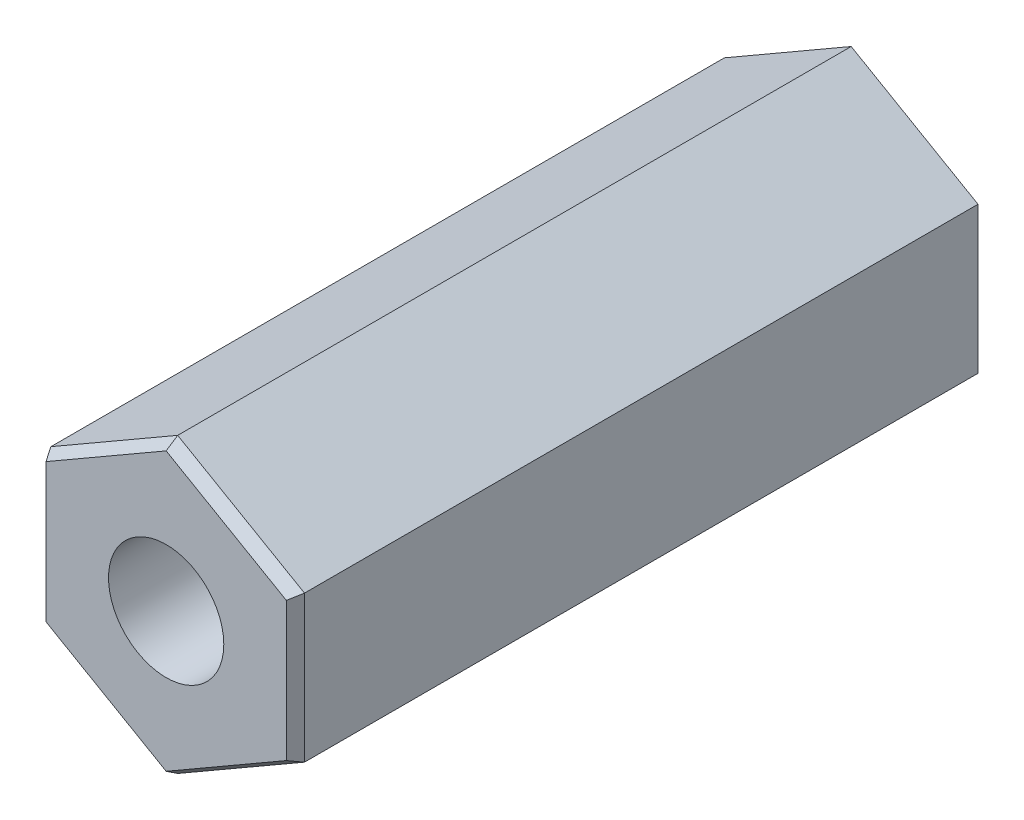
from build123d import *
from OCP.BRepFilletAPI import BRepFilletAPI_MakeChamfer

# Parameters (mm, degrees)
EXTRUDE_1_DEPTH    = 7.5
HOLE_WIZARD_M3_1_D = 2.5
CHAMFER_2_SIZE     = 0.25
CHAMFER_2_SIZE2    = 0.144337567


with BuildPart() as part:
    # ｽｹｯﾁ1 → ﾎﾞｽ - 押し出し1 (new, symmetric)
    with BuildSketch(Plane.XY):
        Polygon((-2.75, 1.58771324), (-2.75, -1.58771324), (0, -3.175426481), (2.75, -1.58771324), (2.75, 1.58771324), (0, 3.175426481), align=None)
    extrude(amount=EXTRUDE_1_DEPTH, both=True)

    # M3 ねじ穴1 (through all)
    with Locations(Plane.XY.offset(7.5)):
        with Locations((0, 0)):
            Hole(HOLE_WIZARD_M3_1_D / 2)

    # 面取り2: one chamfer whose edges measure the first distance from different faces: ONE call of the kernel's chamfer builder (chamfer() names one face for all edges)
    chamfer_2_edges_1 = [part.edges().sort_by_distance(p)[0] for p in [
        (-1.375, 2.38156986, 7.5),
    ]]
    chamfer_2_side_1 = [part.faces().sort_by_distance(p)[0] for p in [
        (-1.375, 2.38156986, 0),
    ]]
    chamfer_2_edges_2 = [part.edges().sort_by_distance(p)[0] for p in [
        (1.375, 2.38156986, 7.5),
    ]]
    chamfer_2_side_2 = [part.faces().sort_by_distance(p)[0] for p in [
        (1.375, 2.38156986, 0),
    ]]
    chamfer_2_edges_3 = [part.edges().sort_by_distance(p)[0] for p in [
        (2.75, 0, 7.5),
    ]]
    chamfer_2_side_3 = [part.faces().sort_by_distance(p)[0] for p in [
        (2.75, 0, 0),
    ]]
    chamfer_2_edges_4 = [part.edges().sort_by_distance(p)[0] for p in [
        (1.375, -2.38156986, 7.5),
    ]]
    chamfer_2_side_4 = [part.faces().sort_by_distance(p)[0] for p in [
        (1.375, -2.38156986, 0),
    ]]
    chamfer_2_edges_5 = [part.edges().sort_by_distance(p)[0] for p in [
        (-1.375, -2.38156986, 7.5),
    ]]
    chamfer_2_side_5 = [part.faces().sort_by_distance(p)[0] for p in [
        (-1.375, -2.38156986, 0),
    ]]
    chamfer_2_edges_6 = [part.edges().sort_by_distance(p)[0] for p in [
        (-2.75, 0, 7.5),
    ]]
    chamfer_2_side_6 = [part.faces().sort_by_distance(p)[0] for p in [
        (-2.75, 0, 0),
    ]]
    chamfer_2_edges_7 = [part.edges().sort_by_distance(p)[0] for p in [
        (2.75, 0, -7.5),
        (1.375, -2.38156986, -7.5),
        (-1.375, -2.38156986, -7.5),
        (-2.75, 0, -7.5),
        (-1.375, 2.38156986, -7.5),
        (1.375, 2.38156986, -7.5),
    ]]
    chamfer_2_side_7 = [part.faces().sort_by_distance(p)[0] for p in [
        (-2.665986112, 0, -7.5),
    ]]
    chamfer_2 = BRepFilletAPI_MakeChamfer(part.part.solid().wrapped)
    for e in chamfer_2_edges_1:
        chamfer_2.Add(CHAMFER_2_SIZE, CHAMFER_2_SIZE2, e.wrapped, chamfer_2_side_1[0].wrapped)  # the first distance lies on this face
    for e in chamfer_2_edges_2:
        chamfer_2.Add(CHAMFER_2_SIZE, CHAMFER_2_SIZE2, e.wrapped, chamfer_2_side_2[0].wrapped)  # the first distance lies on this face
    for e in chamfer_2_edges_3:
        chamfer_2.Add(CHAMFER_2_SIZE, CHAMFER_2_SIZE2, e.wrapped, chamfer_2_side_3[0].wrapped)  # the first distance lies on this face
    for e in chamfer_2_edges_4:
        chamfer_2.Add(CHAMFER_2_SIZE, CHAMFER_2_SIZE2, e.wrapped, chamfer_2_side_4[0].wrapped)  # the first distance lies on this face
    for e in chamfer_2_edges_5:
        chamfer_2.Add(CHAMFER_2_SIZE, CHAMFER_2_SIZE2, e.wrapped, chamfer_2_side_5[0].wrapped)  # the first distance lies on this face
    for e in chamfer_2_edges_6:
        chamfer_2.Add(CHAMFER_2_SIZE, CHAMFER_2_SIZE2, e.wrapped, chamfer_2_side_6[0].wrapped)  # the first distance lies on this face
    for e in chamfer_2_edges_7:
        chamfer_2.Add(CHAMFER_2_SIZE, CHAMFER_2_SIZE2, e.wrapped, chamfer_2_side_7[0].wrapped)  # the first distance lies on this face
    add(Compound.cast(chamfer_2.Shape()), mode=Mode.REPLACE)


solid = part.part
